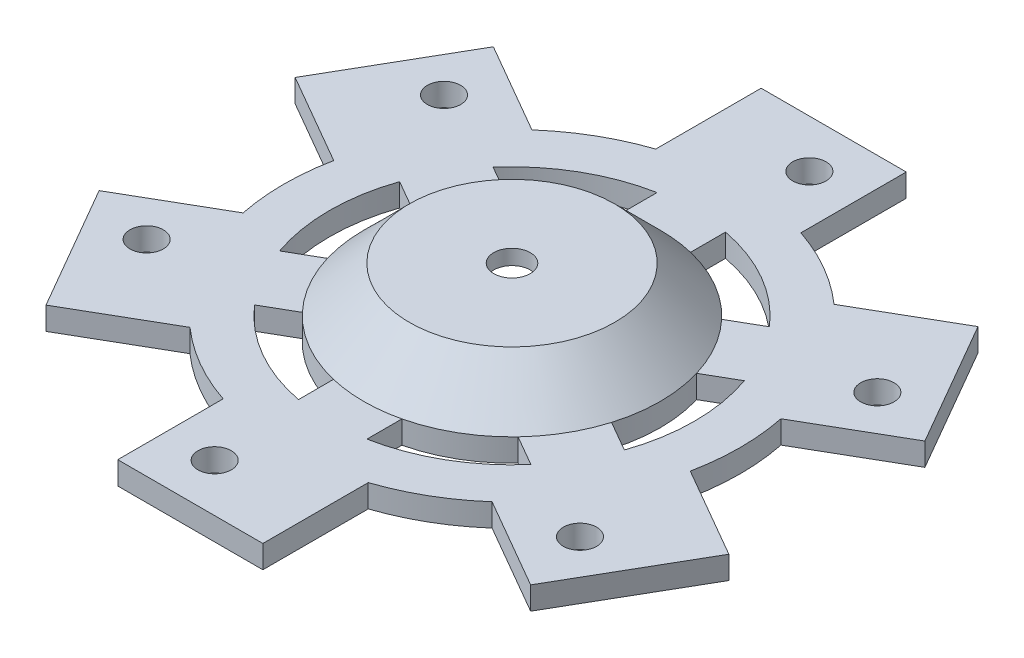
from build123d import *

# Parameters (mm, degrees)
BOSS_EXTRUDE1_DEPTH = 5
CIRPATTERN1_COUNT   = 3
CIRPATTERN1_ANGLE   = 120
SKETCH8_R           = 22.5
BOSS_EXTRUDE4_DEPTH = 10
SKETCH11_R          = 22.5
CUT_EXTRUDE4_DEPTH  = 11.7
SKETCH12_R          = 4
CUT_EXTRUDE5_DEPTH  = 3.3
SKETCH14_R          = 3.65
CUT_EXTRUDE7_DEPTH  = 100.784323589
CIRPATTERN2_COUNT   = 6
CUT_EXTRUDE9_DEPTH  = 15


# Read off the part's stored shape, not the designer's step: Boundary2
with BuildPart() as part:
    # Sketch1 → Boss-Extrude1 (new body)
    with BuildSketch(Plane(origin=(0, 0, 0), x_dir=(1, 0, 0), z_dir=(0, 1, 0))):
        with BuildLine():
            ThreePointArc((-15.9, 47.404535648), (-50, 0), (-15.9, -47.404535648))
            Line((-15.9, -47.404535648), (-15.9, 47.404535648))
        make_face()
        with BuildLine():
            ThreePointArc((-15.9, -47.404535648), (0, -50), (15.9, -47.404535648))
            Line((15.9, -47.404535648), (15.9, 47.404535648))
            ThreePointArc((15.9, 47.404535648), (0, 50), (-15.9, 47.404535648))
            Line((-15.9, 47.404535648), (-15.9, -47.404535648))
        make_face()
        with BuildLine():
            Line((-15.9, -70.5), (15.9, -70.5))
            Line((15.9, -70.5), (15.9, -47.404535648))
            ThreePointArc((15.9, -47.404535648), (0, -50), (-15.9, -47.404535648))
            Line((-15.9, -47.404535648), (-15.9, -70.5))
        make_face()
        with BuildLine():
            ThreePointArc((-15.9, 47.404535648), (0, 50), (15.9, 47.404535648))
            Line((15.9, 47.404535648), (15.9, 70.5))
            Line((15.9, 70.5), (-15.9, 70.5))
            Line((-15.9, 70.5), (-15.9, 47.404535648))
        make_face()
        with BuildLine():
            Line((15.9, 47.404535648), (15.9, -47.404535648))
            ThreePointArc((15.9, -47.404535648), (40.589407485, -29.197602641), (50, 0))
            ThreePointArc((50, 0), (40.589407485, 29.197602641), (15.9, 47.404535648))
        make_face()
    boss_extrude1 = extrude(amount=BOSS_EXTRUDE1_DEPTH)

    # CirPattern1: Boss-Extrude1 ×3 about axis
    cirpattern1_axis = Axis((0, 0, 0), (0, 1, 0))
    for i in range(1, CIRPATTERN1_COUNT):
        add(boss_extrude1.rotate(cirpattern1_axis, i * CIRPATTERN1_ANGLE / (CIRPATTERN1_COUNT - 1)))

    # Sketch8 → Boss-Extrude4 (add)
    with BuildSketch(Plane(origin=(0, 5, 0), x_dir=(1, 0, 0), z_dir=(0, 1, 0))):
        with Locations(Location((0, 0, 0), (0, 0, 270))):
            Circle(SKETCH8_R)
    extrude(amount=BOSS_EXTRUDE4_DEPTH)

    # Boundary2 outline → Boundary2 (revolve)
    with BuildSketch(Plane.XY):
        Polygon((32.5, 5), (22.499998072, 15.000001928), (22.5, 5), align=None)
    revolve(axis=Axis((0, 0, 0), (0, 1, 0)))

    # Sketch11 → Cut-Extrude4 (cut)
    with BuildSketch(Plane.XZ):
        with Locations(Location((0, 0, 0), (0, 0, 270))):
            Circle(SKETCH11_R)
    extrude(amount=-CUT_EXTRUDE4_DEPTH, mode=Mode.SUBTRACT)

    # Sketch12 → Cut-Extrude5 (cut)
    with BuildSketch(Plane.XZ.offset(-11.7)):
        with Locations(Location((0, 0, 0), (0, 0, 270))):
            Circle(SKETCH12_R)
    extrude(amount=-CUT_EXTRUDE5_DEPTH, mode=Mode.SUBTRACT)

    # Sketch14 → Cut-Extrude7 (cut, through all)
    with BuildSketch(Plane(origin=(0, 0, 0), x_dir=(-1, 0, 0), z_dir=(0, -1, 0))):
        with Locations(Location((5.17, -60, 0), (0, 0, 90))):
            Circle(SKETCH14_R)
    cut_extrude7 = extrude(amount=-CUT_EXTRUDE7_DEPTH, mode=Mode.SUBTRACT)

    # CirPattern2: Cut-Extrude7 ×6 about axis
    cirpattern2_axis = Axis((0, 0, 0), (0, 1, 0))
    for i in range(1, CIRPATTERN2_COUNT):
        add(cut_extrude7.rotate(cirpattern2_axis, i * 360 / CIRPATTERN2_COUNT), mode=Mode.SUBTRACT)

    # Sketch15 → Cut-Extrude9 (cut)
    with BuildSketch(Plane(origin=(0, 5, 0), x_dir=(1, 0, 0), z_dir=(0, 1, 0))):
        with BuildLine():
            Line((-37.776643972, 13.150101528), (-31.136127875, 9.316197772))
            ThreePointArc((-31.136127875, 9.316197772), (-32.5, 0), (-31.136127875, -9.316197772))
            Line((-31.136127875, -9.316197772), (-37.776643972, -13.150101528))
            ThreePointArc((-37.776643972, -13.150101528), (-40, 0), (-37.776643972, 13.150101528))
        make_face()
        with BuildLine():
            Line((-30.276643972, 26.140482585), (-23.636127875, 22.306578829))
            ThreePointArc((-23.636127875, 22.306578829), (-16.25, 28.145825623), (-7.5, 31.622776602))
            Line((-7.5, 31.622776602), (-7.5, 39.290584114))
            ThreePointArc((-7.5, 39.290584114), (-20, 34.641016151), (-30.276643972, 26.140482585))
        make_face()
        with BuildLine():
            Line((7.5, 39.290584114), (7.5, 31.622776602))
            ThreePointArc((7.5, 31.622776602), (16.25, 28.145825623), (23.636127875, 22.306578829))
            Line((23.636127875, 22.306578829), (30.276643972, 26.140482585))
            ThreePointArc((30.276643972, 26.140482585), (20, 34.641016151), (7.5, 39.290584114))
        make_face()
        with BuildLine():
            Line((37.776643972, 13.150101528), (31.136127875, 9.316197772))
            ThreePointArc((31.136127875, 9.316197772), (32.5, 0), (31.136127875, -9.316197772))
            Line((31.136127875, -9.316197772), (37.776643972, -13.150101528))
            ThreePointArc((37.776643972, -13.150101528), (40, 0), (37.776643972, 13.150101528))
        make_face()
        with BuildLine():
            Line((30.276643972, -26.140482585), (23.636127875, -22.306578829))
            ThreePointArc((23.636127875, -22.306578829), (16.25, -28.145825623), (7.5, -31.622776602))
            Line((7.5, -31.622776602), (7.5, -39.290584114))
            ThreePointArc((7.5, -39.290584114), (20, -34.641016151), (30.276643972, -26.140482585))
        make_face()
        with BuildLine():
            Line((-7.5, -39.290584114), (-7.5, -31.622776602))
            ThreePointArc((-7.5, -31.622776602), (-16.25, -28.145825623), (-23.636127875, -22.306578829))
            Line((-23.636127875, -22.306578829), (-30.276643972, -26.140482585))
            ThreePointArc((-30.276643972, -26.140482585), (-20, -34.641016151), (-7.5, -39.290584114))
        make_face()
    extrude(amount=-CUT_EXTRUDE9_DEPTH, mode=Mode.SUBTRACT)


solid = part.part
